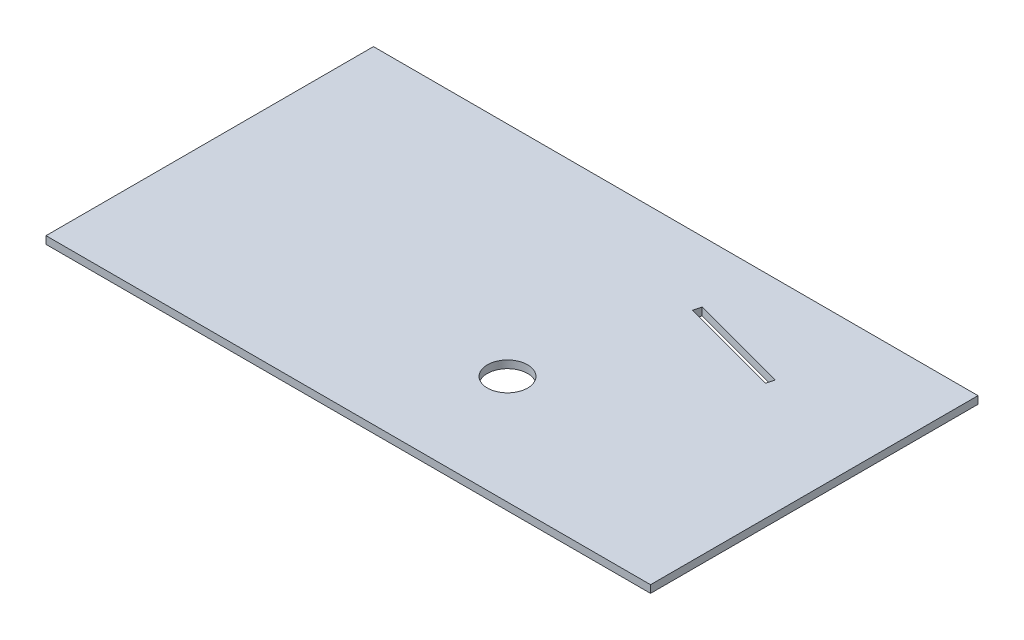
from build123d import *

# Parameters (mm, degrees)
BOSS_EXTRUDE1_DEPTH = 50.8
SKETCH4_W           = 1524
SKETCH4_H           = 825.5
BOSS_EXTRUDE2_DEPTH = 19.05
SKETCH7_W           = 50.8
SKETCH7_H           = 19.05
SKETCH8_W           = 1.5875
SKETCH8_H           = 50.8
BOSS_EXTRUDE3_DEPTH = 204
CUT_EXTRUDE1_DEPTH  = 1048.186527675


with BuildPart() as part:
    # Sketch3 → Boss-Extrude1 (new body)
    with BuildSketch(Plane(origin=(0, 0, 0), x_dir=(1, 0, 0), z_dir=(0, 1, 0))):
        with BuildLine():
            Line((-524, 0), (-525.5875, 0))
            ThreePointArc((-525.5875, 0), (-255.243310314, 459.448661655), (277.677694458, 446.248045549))
            Line((277.677694458, 446.248045549), (277.677694458, 444.377202386))
            ThreePointArc((277.677694458, 444.377202386), (-254.040241009, 458.300726541), (-524, 0))
        make_face()
    extrude(amount=BOSS_EXTRUDE1_DEPTH)

    # Sketch8 → Boss-Extrude3 (add)
    with BuildSketch(Plane.XY):
        with Locations((-524.79375, 25.4)):
            Rectangle(SKETCH8_W, SKETCH8_H)
    extrude(amount=BOSS_EXTRUDE3_DEPTH)


with BuildPart() as body_2:
    # Sketch4 → Boss-Extrude2 (new body)
    with BuildSketch(Plane(origin=(0, 50.8, 0), x_dir=(1, 0, 0), z_dir=(0, 1, 0))):
        with Locations((-127, 138.338)):
            Rectangle(SKETCH4_W, SKETCH4_H)
    extrude(amount=BOSS_EXTRUDE2_DEPTH)

    # Sketch7 → Ø20.0mm Dowel Hole1 (revolve, cut)
    with BuildSketch(Plane(origin=(0, 50.8, 0), x_dir=(0, 0, -1), z_dir=(1, 0, 0))):
        with Locations((25.4, 9.525)):
            Rectangle(SKETCH7_W, SKETCH7_H)
    revolve(axis=Axis((0, 44.45, 0), (0, 1, 0)), mode=Mode.SUBTRACT)

    # Sketch9 → Cut-Extrude1 (cut, through all)
    with BuildSketch(Plane(origin=(0, 50.8, 0), x_dir=(-1, 0, 0), z_dir=(0, -1, 0))):
        Polygon((-94.035666067, 396.611468252), (-345.176380902, 329.318516526), (-340, 310), (-88.859285165, 377.292951727), align=None)
    extrude(amount=-CUT_EXTRUDE1_DEPTH, mode=Mode.SUBTRACT)


solid = Compound([part.part, body_2.part])
